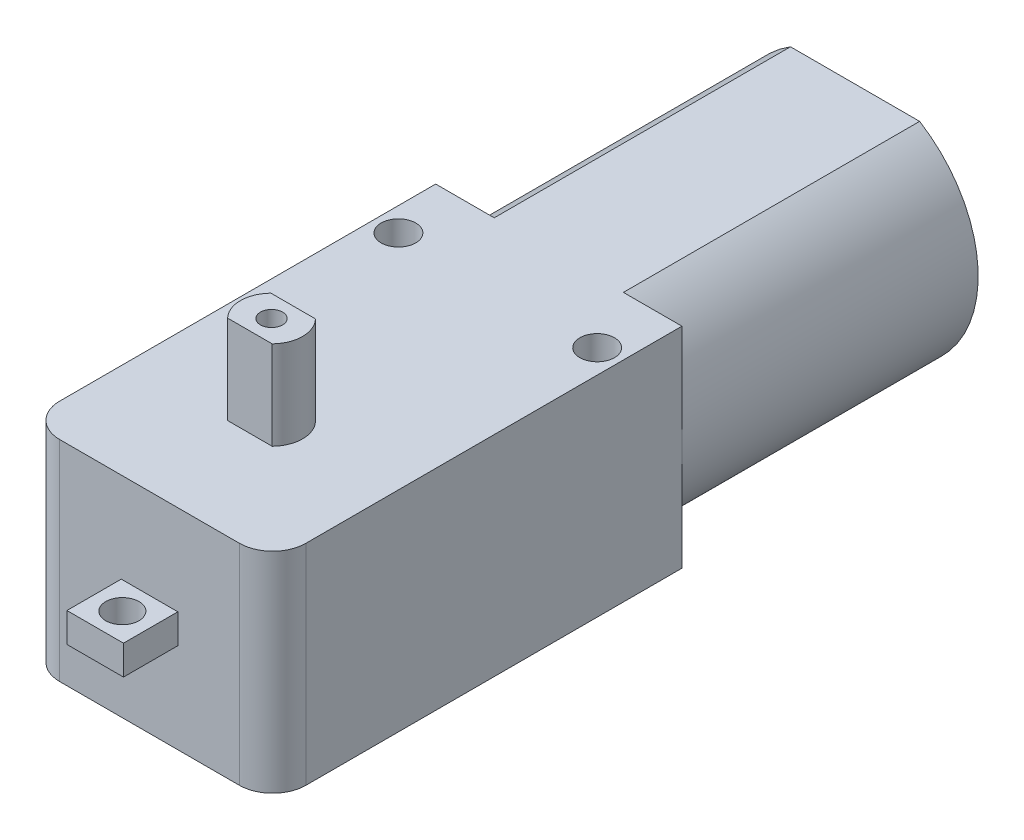
from build123d import *

# Parameters (mm, degrees)
SKETCH1_W           = 22.2
SKETCH1_H           = 18.9
BOSS_EXTRUDE1_DEPTH = 36.9
SKETCH2_W           = 5.1
SKETCH2_H           = 2.65
BOSS_EXTRUDE2_DEPTH = 4.9
BOSS_EXTRUDE3_DEPTH = 26.71
SKETCH4_R           = 1
BOSS_EXTRUDE4_DEPTH = 1
BOSS_EXTRUDE5_DEPTH = 8
BOSS_EXTRUDE6_START = 8
BOSS_EXTRUDE6_DEPTH = 8
SKETCH8_R           = 1.5
CUT_EXTRUDE1_DEPTH  = 71.850495588
SKETCH9_R           = 1
CUT_EXTRUDE2_DEPTH  = 77.715722639
SKETCH10_R          = 1.56
CUT_EXTRUDE3_DEPTH  = 74.422762819
FILLET1_R           = 3


with BuildPart() as part:
    # Sketch1 → Boss-Extrude1 (new body)
    with BuildSketch(Plane.XY):
        with Locations((11.1, 9.45)):
            Rectangle(SKETCH1_W, SKETCH1_H)
    extrude(amount=-BOSS_EXTRUDE1_DEPTH)

    # Sketch2 → Boss-Extrude2 (add)
    with BuildSketch(Plane.XY):
        with Locations((11.1, 9.45)):
            Rectangle(SKETCH2_W, SKETCH2_H)
    extrude(amount=BOSS_EXTRUDE2_DEPTH)

    # Sketch3 → Boss-Extrude3 (add)
    with BuildSketch(Plane(origin=(0, 0, -36.9), x_dir=(-1, 0, 0), z_dir=(0, 0, -1))):
        with BuildLine():
            Line((-16.923014683, 18.9), (-5.276985317, 18.9))
            ThreePointArc((-5.276985317, 18.9), (0, 9.45), (-5.276985317, 0))
            Line((-5.276985317, 0), (-16.923014683, 0))
            ThreePointArc((-16.923014683, 0), (-22.2, 9.45), (-16.923014683, 18.9))
        make_face()
    extrude(amount=BOSS_EXTRUDE3_DEPTH)

    # Sketch4 → Boss-Extrude4 (add)
    with BuildSketch(Plane(origin=(0, 0, -63.61), x_dir=(-1, 0, 0), z_dir=(0, 0, -1))):
        with Locations((-11.1, 9.45)):
            Circle(SKETCH4_R)
    extrude(amount=BOSS_EXTRUDE4_DEPTH)

    # Sketch5 → Boss-Extrude5 (add)
    with BuildSketch(Plane(origin=(0, 18.9, 0), x_dir=(1, 0, 0), z_dir=(0, 1, 0))):
        with BuildLine():
            Line((9.09064687, 12.95), (13.10935313, 12.95))
            ThreePointArc((13.10935313, 12.95), (13.9, 11), (13.10935313, 9.05))
            Line((13.10935313, 9.05), (9.09064687, 9.05))
            ThreePointArc((9.09064687, 9.05), (8.3, 11), (9.09064687, 12.95))
        make_face()
    extrude(amount=BOSS_EXTRUDE5_DEPTH)

    # Sketch6 → Boss-Extrude6 (add)
    with BuildSketch(Plane.XZ.offset(BOSS_EXTRUDE6_START)):
        with BuildLine():
            Line((9.09064687, -9.05), (13.10935313, -9.05))
            ThreePointArc((13.10935313, -9.05), (13.9, -11), (13.10935313, -12.95))
            Line((13.10935313, -12.95), (9.09064687, -12.95))
            ThreePointArc((9.09064687, -12.95), (8.3, -11), (9.09064687, -9.05))
        make_face()
    extrude(amount=-BOSS_EXTRUDE6_DEPTH)

    # Sketch8 → Cut-Extrude1 (cut, through all)
    with BuildSketch(Plane(origin=(0, 10.775, 0), x_dir=(1, 0, 0), z_dir=(0, 1, 0))):
        with Locations((11.1, -2.45)):
            Circle(SKETCH8_R)
    extrude(amount=-CUT_EXTRUDE1_DEPTH, mode=Mode.SUBTRACT)

    # Sketch9 → Cut-Extrude2 (cut, through all)
    with BuildSketch(Plane(origin=(0, 26.9, 0), x_dir=(1, 0, 0), z_dir=(0, 1, 0))):
        with Locations((11.1, 11)):
            Circle(SKETCH9_R)
    extrude(amount=-CUT_EXTRUDE2_DEPTH, mode=Mode.SUBTRACT)

    # Sketch10 → Cut-Extrude3 (cut, through all)
    with BuildSketch(Plane(origin=(0, 18.9, 0), x_dir=(1, 0, 0), z_dir=(0, 1, 0))):
        with Locations((2.14, 31.4)):
            Circle(SKETCH10_R)
        with Locations((20.06, 31.4)):
            Circle(SKETCH10_R)
    extrude(amount=-CUT_EXTRUDE3_DEPTH, mode=Mode.SUBTRACT)

    # Fillet1
    fillet1_edges = [part.edges().sort_by_distance(p)[0] for p in [
        (0, 9.45, 0),
        (22.2, 9.45, 0),
    ]]
    fillet(fillet1_edges, radius=FILLET1_R)


solid = part.part
